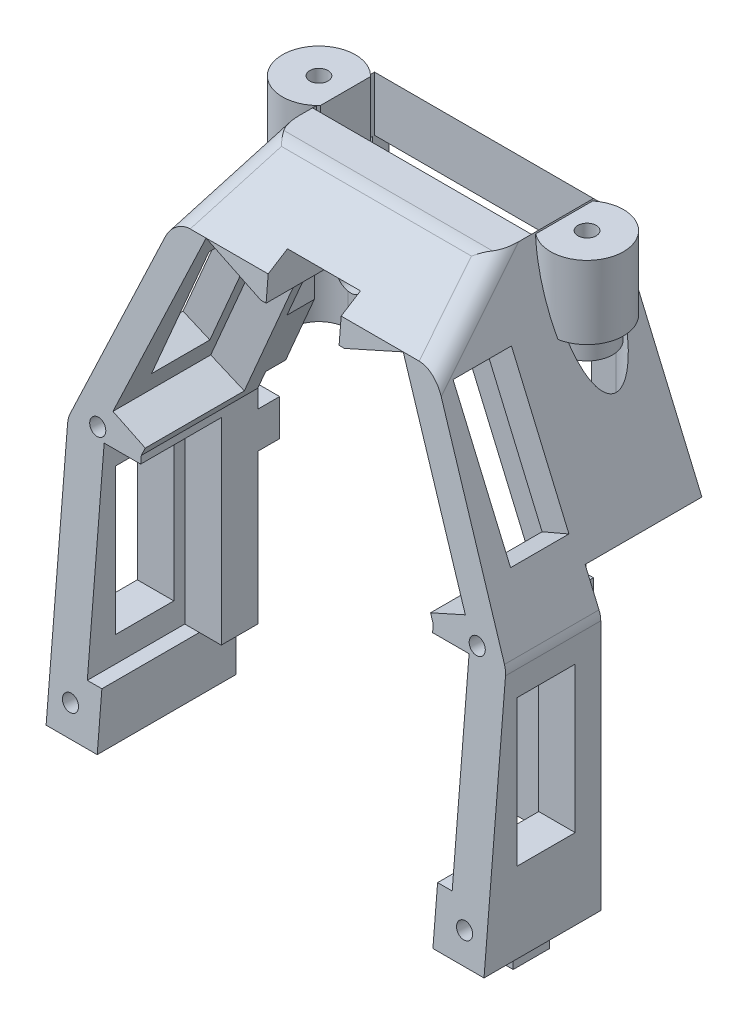
from build123d import *

# Parameters (mm, degrees)
BOSS_EXTRUDE1_DEPTH = 32
CUT_EXTRUDE1_START  = 52.5
SKETCH2_W           = 30
SKETCH2_H           = 8.5
CUT_EXTRUDE1_DEPTH  = 25
CUT_EXTRUDE3_START  = 20
SKETCH3_W           = 30
SKETCH3_H           = 14
CUT_EXTRUDE3_DEPTH  = 25
CUT_EXTRUDE4_START  = 32
SKETCH4_W           = 10
SKETCH4_H           = 5
CUT_EXTRUDE4_DEPTH  = 21.5
CUT_EXTRUDE5_START  = 30
SKETCH5_W           = 8
SKETCH5_H           = 20
SKETCH5_W_2         = 13
SKETCH5_H_2         = 38
CUT_EXTRUDE5_DEPTH  = 60
SKETCH6_W           = 14
SKETCH6_H           = 27
CUT_EXTRUDE6_DEPTH  = 25
CUT_EXTRUDE7_START  = -30
SKETCH7_W           = 16
SKETCH7_H           = 40
CUT_EXTRUDE7_DEPTH  = 5
CUT_EXTRUDE8_START  = 30
SKETCH7_2_W         = 16
SKETCH7_2_H         = 40
CUT_EXTRUDE8_DEPTH  = 5
CUT_EXTRUDE9_START  = -10
SKETCH8_W           = 8
SKETCH8_H           = 20
CUT_EXTRUDE9_DEPTH  = 15
CUT_EXTRUDE10_START = -10
SKETCH9_W           = 8
SKETCH9_H           = 20
CUT_EXTRUDE10_DEPTH = 15
CUT_EXTRUDE11_START = -14
SKETCH11_W          = 16.7
SKETCH11_H          = 27
CUT_EXTRUDE11_DEPTH = 15
CUT_EXTRUDE12_START = -14
SKETCH12_W          = 16.7
SKETCH12_H          = 27
CUT_EXTRUDE12_DEPTH = 16
CUT_EXTRUDE13_DEPTH = 31
CUT_EXTRUDE14_DEPTH = 31
BOSS_EXTRUDE2_START = 45
SKETCH16_R          = 3.5
SKETCH16_R_2        = 1.25
BOSS_EXTRUDE2_DEPTH = 5.5
CUT_EXTRUDE15_START = -10
SKETCH17_R          = 1.1
CUT_EXTRUDE15_DEPTH = 10
FILLET3_R           = 3
CHAMFER1_SIZE       = 2
SKETCH18_R          = 1.6
CUT_EXTRUDE16_DEPTH = 6
CUT_EXTRUDE17_START = 13
SKETCH19_W          = 3
SKETCH19_H          = 7.5
CUT_EXTRUDE17_DEPTH = 19
BOSS_EXTRUDE4_START = -17.5
SKETCH21_W          = 2
SKETCH21_H          = 5
BOSS_EXTRUDE4_DEPTH = 3
BOSS_EXTRUDE5_START = 13
SKETCH22_W          = 3
SKETCH22_H          = 5
BOSS_EXTRUDE5_DEPTH = 3
CUT_EXTRUDE18_START = 15.3
CUT_EXTRUDE18_DEPTH = 6
CUT_EXTRUDE20_DEPTH = 42
CUT_EXTRUDE21_START = 49.5
CUT_EXTRUDE21_DEPTH = 10
BOSS_EXTRUDE6_START = 52.5
SKETCH26_R          = 1.25
BOSS_EXTRUDE6_DEPTH = 10


with BuildPart() as part:
    # Sketch1 → Boss-Extrude1 (new body)
    with BuildSketch(Plane.XY):
        Polygon((-30, 17.5), (-15, 52.5), (15, 52.5), (30, 17.5), (30, -17.5), (20, -17.5), (20, 15.44742298), (8.40603842, 42.5), (-8.40603842, 42.5), (-20, 15.44742298), (-20, -17.5), (-30, -17.5), align=None)
    extrude(amount=BOSS_EXTRUDE1_DEPTH)

    # Sketch2 → Cut-Extrude1 (cut)
    with BuildSketch(Plane(origin=(0, 0, 0), x_dir=(1, 0, 0), z_dir=(0, 1, 0)).offset(CUT_EXTRUDE1_START)):
        with Locations((0, -6.25)):
            Rectangle(SKETCH2_W, SKETCH2_H)
    extrude(amount=-CUT_EXTRUDE1_DEPTH, mode=Mode.SUBTRACT)

    # Sketch3 → Cut-Extrude3 (cut)
    with BuildSketch(Plane(origin=(0, 0, 0), x_dir=(1, 0, 0), z_dir=(0, 1, 0)).offset(CUT_EXTRUDE3_START)):
        with Locations((0, -7)):
            Rectangle(SKETCH3_W, SKETCH3_H)
        with BuildLine():
            Line((18.37, -10.25), (-18.37, -10.25))
            ThreePointArc((-18.37, -10.25), (-22.37, -6.25), (-18.37, -2.25))
            Line((-18.37, -2.25), (18.37, -2.25))
            ThreePointArc((18.37, -2.25), (22.37, -6.25), (18.37, -10.25))
        make_face()
    extrude(amount=CUT_EXTRUDE3_DEPTH, mode=Mode.SUBTRACT)

    # Sketch4 → Cut-Extrude4 (cut)
    with BuildSketch(Plane.XY.offset(CUT_EXTRUDE4_START)):
        with Locations((0, 45)):
            Rectangle(SKETCH4_W, SKETCH4_H)
    extrude(amount=-CUT_EXTRUDE4_DEPTH, mode=Mode.SUBTRACT)

    # Sketch5 → Cut-Extrude5 (cut)
    with BuildSketch(Plane(origin=(0, 0, 0), x_dir=(0, 0, -1), z_dir=(1, 0, 0)).offset(CUT_EXTRUDE5_START)):
        with Locations((-23.5, 3.5)):
            Rectangle(SKETCH5_W, SKETCH5_H)
        with Locations((-6.5, 1.5)):
            Rectangle(SKETCH5_W_2, SKETCH5_H_2)
    extrude(amount=-CUT_EXTRUDE5_DEPTH, mode=Mode.SUBTRACT)

    # Sketch6 → Cut-Extrude6 (cut, symmetric)
    with BuildSketch(Plane(origin=(0, 0, 0), x_dir=(0, 0, -1), z_dir=(1, 0, 0))):
        with Locations((-25, 3.5)):
            Rectangle(SKETCH6_W, SKETCH6_H)
    extrude(amount=CUT_EXTRUDE6_DEPTH, both=True, mode=Mode.SUBTRACT)

    # Sketch7 → Cut-Extrude7 (cut)
    with BuildSketch(Plane(origin=(0, 0, 0), x_dir=(0, 0, -1), z_dir=(1, 0, 0)).offset(CUT_EXTRUDE7_START)):
        with Locations((-8, 2.5)):
            Rectangle(SKETCH7_W, SKETCH7_H)
    extrude(amount=CUT_EXTRUDE7_DEPTH, mode=Mode.SUBTRACT)

    # Sketch7<2> → Cut-Extrude8 (cut)
    with BuildSketch(Plane(origin=(0, 0, 0), x_dir=(0, 0, -1), z_dir=(1, 0, 0)).offset(CUT_EXTRUDE8_START)):
        with Locations((-8, 2.5)):
            Rectangle(SKETCH7_2_W, SKETCH7_2_H)
    extrude(amount=-CUT_EXTRUDE8_DEPTH, mode=Mode.SUBTRACT)

    # Sketch8 → Cut-Extrude9 (cut)
    with BuildSketch(Plane(origin=(-40.872484783, 17.516779193, 0), x_dir=(0, 0, 1), z_dir=(-0.9191450300180579, 0.3939192985791677, 0)).offset(CUT_EXTRUDE9_START)):
        with Locations((20.8, 23.306891833)):
            Rectangle(SKETCH8_W, SKETCH8_H)
    extrude(amount=-CUT_EXTRUDE9_DEPTH, mode=Mode.SUBTRACT)

    # Sketch9 → Cut-Extrude10 (cut)
    with BuildSketch(Plane(origin=(40.872484783, 17.516779193, 0), x_dir=(0, 0, -1), z_dir=(0.9191450300180579, 0.3939192985791677, 0)).offset(CUT_EXTRUDE10_START)):
        with Locations((-20.8, 23.306891833)):
            Rectangle(SKETCH9_W, SKETCH9_H)
    extrude(amount=-CUT_EXTRUDE10_DEPTH, mode=Mode.SUBTRACT)

    # Sketch11 → Cut-Extrude11 (cut)
    with BuildSketch(Plane(origin=(-40.872484783, 17.516779193, 0), x_dir=(0, 0, 1), z_dir=(-0.9191450300180579, 0.3939192985791677, 0)).offset(CUT_EXTRUDE11_START)):
        with Locations((23.65, 23.306891833)):
            Rectangle(SKETCH11_W, SKETCH11_H)
    extrude(amount=-CUT_EXTRUDE11_DEPTH, mode=Mode.SUBTRACT)

    # Sketch12 → Cut-Extrude12 (cut)
    with BuildSketch(Plane(origin=(40.872484783, 17.516779193, 0), x_dir=(0, 0, -1), z_dir=(0.9191450300180579, 0.3939192985791677, 0)).offset(CUT_EXTRUDE12_START)):
        with Locations((-23.65, 23.306891833)):
            Rectangle(SKETCH12_W, SKETCH12_H)
    extrude(amount=-CUT_EXTRUDE12_DEPTH, mode=Mode.SUBTRACT)

    # Sketch13 → Cut-Extrude13 (cut, symmetric)
    with BuildSketch(Plane(origin=(0, 0, 0), x_dir=(0, 0, -1), z_dir=(1, 0, 0))):
        Polygon((-32, 52.5), (-26, 52.5), (-32, -17.5), align=None)
    extrude(amount=CUT_EXTRUDE13_DEPTH, both=True, mode=Mode.SUBTRACT)

    # Sketch14 → Cut-Extrude14 (cut, symmetric)
    with BuildSketch(Plane(origin=(0, 0, 0), x_dir=(0, 0, -1), z_dir=(1, 0, 0))):
        Polygon((-16, 52.5), (-26, 52.5), (-26.571475939, 45.832780711), align=None)
    extrude(amount=CUT_EXTRUDE14_DEPTH, both=True, mode=Mode.SUBTRACT)

    # Sketch16 → Boss-Extrude2 (add)
    # profile 1 of 2: a face of its own
    with BuildSketch(Plane(origin=(0, 0, 0), x_dir=(1, 0, 0), z_dir=(0, 1, 0)).offset(BOSS_EXTRUDE2_START)):
        with Locations(Location((18.37, -6.25, 0), (0, 0, 270))):
            Circle(SKETCH16_R)
        with Locations(Location((18.37, -6.25, 0), (0, 0, 270))):
            Circle(SKETCH16_R_2, mode=Mode.SUBTRACT)
    # profile 2 of 2: a face of its own
    with BuildSketch(Plane(origin=(0, 0, 0), x_dir=(1, 0, 0), z_dir=(0, 1, 0)).offset(BOSS_EXTRUDE2_START)):
        with Locations(Location((-18.37, -6.25, 0), (0, 0, 270))):
            Circle(SKETCH16_R)
        with Locations(Location((-18.37, -6.25, 0), (0, 0, 270))):
            Circle(SKETCH16_R_2, mode=Mode.SUBTRACT)
    extrude(amount=-BOSS_EXTRUDE2_DEPTH)

    # Sketch17 → Cut-Extrude15 (cut)
    with BuildSketch(Plane(origin=(0, 3.449230214, 40.241019165), x_dir=(1, 0, 0), z_dir=(0, 0.08540114134643577, 0.9963466490417511)).offset(CUT_EXTRUDE15_START)):
        with Locations(Location((-27, -16.168902881, 0), (0, 0, 90))):
            Circle(SKETCH17_R)
        with Locations(Location((-26, 15.831097119, 0), (0, 0, 90))):
            Circle(SKETCH17_R)
        with Locations(Location((27, -16.168902881, 0), (0, 0, 90))):
            Circle(SKETCH17_R)
        with Locations(Location((26, 15.831097119, 0), (0, 0, 90))):
            Circle(SKETCH17_R)
    extrude(amount=-CUT_EXTRUDE15_DEPTH, mode=Mode.SUBTRACT)

    # Fillet3
    fillet3_edges = [part.edges().sort_by_distance(p)[0] for p in [
        (30, 17.5, 22.5),
        (-30, 17.5, 22.5),
        (0, 52.5, 16),
        (16.428689848, 49.166390355, 21.28573797),
        (-16.428689848, 49.166390355, 21.28573797),
    ]]
    fillet(fillet3_edges, radius=FILLET3_R)

    # Chamfer1
    chamfer1_edges = [part.edges().sort_by_distance(p)[0] for p in [
        (0, 52.5, 0),
    ]]
    chamfer(chamfer1_edges, length=CHAMFER1_SIZE - 0.0001)  # a hair under: the kernel refuses the full size

    # Sketch18 → Cut-Extrude16 (cut)
    with BuildSketch(Plane.XY):
        with Locations(Location((18, 26.5, 0), (0, 0, 283.370675639))):
            Circle(SKETCH18_R)
        with Locations(Location((-18, 26.5, 0), (0, 0, 180))):
            Circle(SKETCH18_R)
    extrude(amount=CUT_EXTRUDE16_DEPTH, mode=Mode.SUBTRACT)

    # Sketch19 → Cut-Extrude17 (cut)
    with BuildSketch(Plane.XY.offset(CUT_EXTRUDE17_START)):
        with Locations((-21.5, -13.75)):
            Rectangle(SKETCH19_W, SKETCH19_H)
        with Locations((21.5, -13.75)):
            Rectangle(SKETCH19_W, SKETCH19_H)
    extrude(amount=CUT_EXTRUDE17_DEPTH, mode=Mode.SUBTRACT)

    # Sketch21 → Boss-Extrude4 (add)
    with BuildSketch(Plane(origin=(0, 0, 0), x_dir=(1, 0, 0), z_dir=(0, 1, 0)).offset(BOSS_EXTRUDE4_START)):
        with Locations((-27, -23.5)):
            Rectangle(SKETCH21_W, SKETCH21_H)
        with Locations((27, -23.5)):
            Rectangle(SKETCH21_W, SKETCH21_H)
    extrude(amount=-BOSS_EXTRUDE4_DEPTH)

    # Sketch22 → Boss-Extrude5 (add)
    with BuildSketch(Plane.XY.offset(BOSS_EXTRUDE5_START)):
        with Locations((-21.5, 13)):
            Rectangle(SKETCH22_W, SKETCH22_H)
        with Locations((21.5, 13)):
            Rectangle(SKETCH22_W, SKETCH22_H)
    extrude(amount=-BOSS_EXTRUDE5_DEPTH)

    # Sketch23 → Cut-Extrude18 (cut)
    with BuildSketch(Plane.XY.offset(CUT_EXTRUDE18_START)):
        Polygon((-16.063333209, 17.5538661), (-19.545605261, 19.046268408), (-8.909784199, 43.863184218), (-5.427512148, 42.37078191), align=None)
        Polygon((16.063333209, 17.5538661), (19.545605261, 19.046268408), (8.909784199, 43.863184218), (5.427512148, 42.37078191), align=None)
    extrude(amount=-CUT_EXTRUDE18_DEPTH, mode=Mode.SUBTRACT)

    # Sketch24 → Cut-Extrude20 (cut)
    with BuildSketch(Plane.XY):
        Polygon((-20, 15.44742298), (-20, 17.986014016), (-19.076948331, 20.139801243), (-18.160478874, 19.739638942), align=None)
        Polygon((20, 15.44742298), (18.160478874, 19.739638942), (19.076948331, 20.139801243), (20, 17.986014016), align=None)
    extrude(amount=CUT_EXTRUDE20_DEPTH, mode=Mode.SUBTRACT)

    # Sketch25 → Cut-Extrude21 (cut)
    with BuildSketch(Plane(origin=(0, 0, 0), x_dir=(1, 0, 0), z_dir=(0, 1, 0)).offset(CUT_EXTRUDE21_START)):
        with BuildLine():
            Line((-15, -7.195039682), (-15, -5.304960318))
            ThreePointArc((-15, -5.304960318), (-14.87, -6.25), (-15, -7.195039682))
        make_face()
        with BuildLine():
            Line((15, -7.195039682), (15, -5.304960318))
            ThreePointArc((15, -5.304960318), (14.87, -6.25), (15, -7.195039682))
        make_face()
    extrude(amount=-CUT_EXTRUDE21_DEPTH, mode=Mode.SUBTRACT)

    # Sketch26 → Boss-Extrude6 (add)
    # profile 1 of 2: a face of its own
    with BuildSketch(Plane(origin=(0, 0, 0), x_dir=(1, 0, 0), z_dir=(0, 1, 0)).offset(BOSS_EXTRUDE6_START)):
        with BuildLine():
            Line((-14.74078782, -9.68930501), (-14.74078782, -2.81069499))
            ThreePointArc((-14.74078782, -2.81069499), (-23.37, -6.25), (-14.74078782, -9.68930501))
        make_face()
        with Locations(Location((-18.37, -6.25, 0), (0, 0, 270))):
            Circle(SKETCH26_R, mode=Mode.SUBTRACT)
    # profile 2 of 2: a face of its own
    with BuildSketch(Plane(origin=(0, 0, 0), x_dir=(1, 0, 0), z_dir=(0, 1, 0)).offset(BOSS_EXTRUDE6_START)):
        with BuildLine():
            Line((15.237989525, -10.147500531), (15.237989525, -2.352499469))
            ThreePointArc((15.237989525, -2.352499469), (23.37, -6.25), (15.237989525, -10.147500531))
        make_face()
        with Locations(Location((18.37, -6.25, 0), (0, 0, 270))):
            Circle(SKETCH26_R, mode=Mode.SUBTRACT)
    extrude(amount=-BOSS_EXTRUDE6_DEPTH)


solid = part.part
